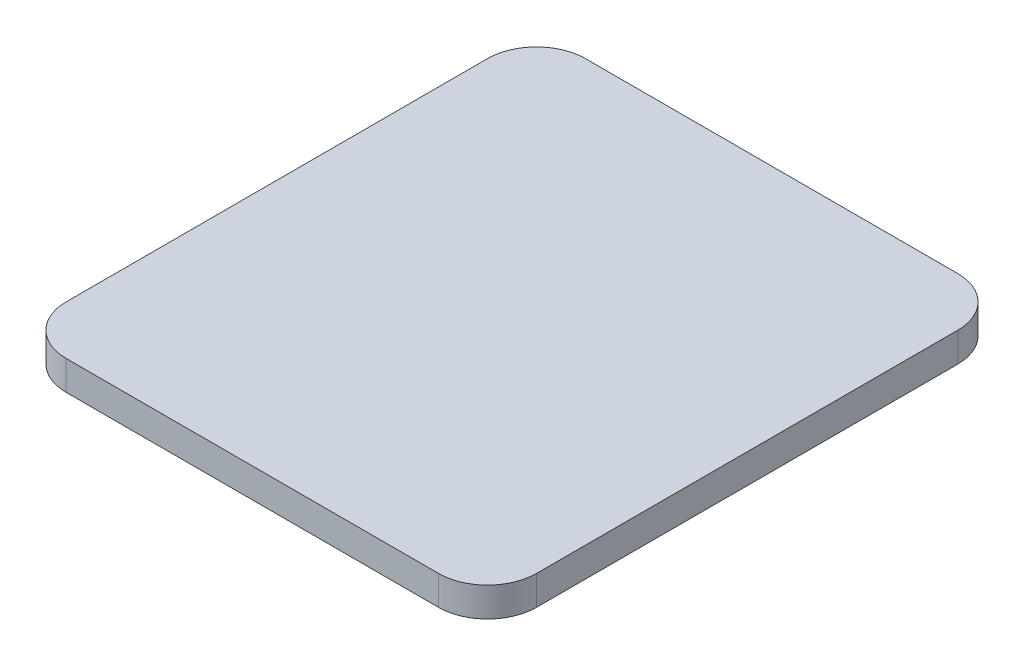
from build123d import *

# Parameters (mm, degrees)
BOSS_EXTRUDE1_DEPTH = 3


with BuildPart() as part:
    # Sketch1 → Boss-Extrude1 (new body)
    with BuildSketch(Plane.XZ.offset(-29.171825564)):
        with BuildLine():
            Line((13.921525611, 29.780531955), (51.921525611, 29.780531955))
            ThreePointArc((51.921525611, 29.780531955), (55.457059517, 31.244998049), (56.921525611, 34.780531955))
            Line((56.921525611, 34.780531955), (56.921525611, 77.780531955))
            ThreePointArc((56.921525611, 77.780531955), (55.457059517, 81.316065861), (51.921525611, 82.780531955))
            Line((51.921525611, 82.780531955), (13.921525611, 82.780531955))
            ThreePointArc((13.921525611, 82.780531955), (10.385991705, 81.316065861), (8.921525611, 77.780531955))
            Line((8.921525611, 77.780531955), (8.921525611, 34.780531955))
            ThreePointArc((8.921525611, 34.780531955), (10.385991705, 31.244998049), (13.921525611, 29.780531955))
        make_face()
    extrude(amount=BOSS_EXTRUDE1_DEPTH)


solid = part.part
